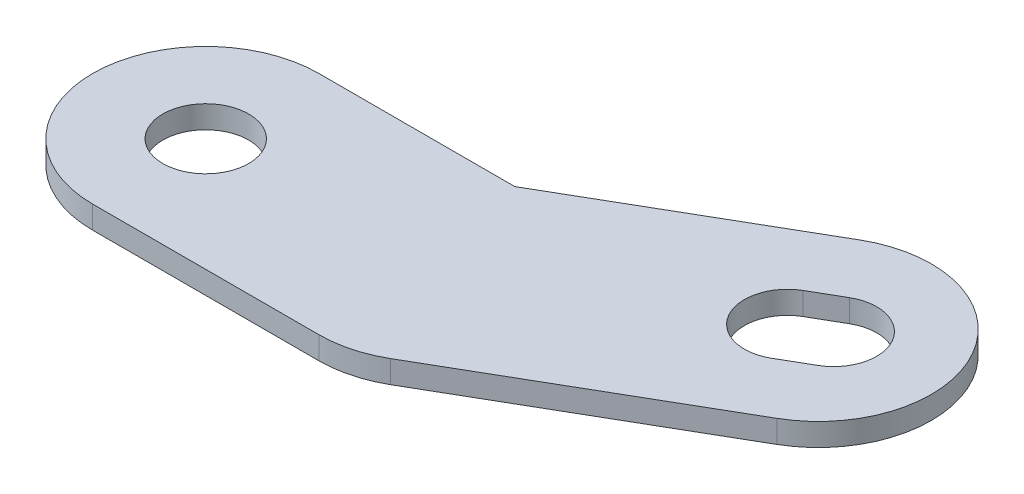
from build123d import *

# Parameters (mm, degrees)
BOSS_EXTRUDE1_DEPTH   = 1
F_6_CLEARANCE_HOLE1_D = 3.7973


with BuildPart() as part:
    # Sketch1 → Boss-Extrude1 (new body)
    # profile 1 of 3: a face of its own
    with BuildSketch(Plane(origin=(0, 0, 0), x_dir=(1, 0, 0), z_dir=(0, 1, 0))):
        with BuildLine():
            Line((0.660254038, 5), (-8, 5))
            ThreePointArc((-8, 5), (-13, 0), (-8, -5))
            Line((-8, -5), (2, -5))
            ThreePointArc((2, -5), (-2.829629131, -1.294095226), (-0.5, 4.330127019))
            Line((-0.5, 4.330127019), (0.660254038, 5))
        make_face()
    # profile 2 of 3: a face of its own
    with BuildSketch(Plane(origin=(0, 0, 0), x_dir=(1, 0, 0), z_dir=(0, 1, 0))):
        with BuildLine():
            Line((2, 5), (0.660254038, 5))
            Line((0.660254038, 5), (-0.5, 4.330127019))
            ThreePointArc((-0.5, 4.330127019), (-2.829629131, -1.294095226), (2, -5))
            ThreePointArc((2, -5), (3.294095226, -4.829629131), (4.5, -4.330127019))
            ThreePointArc((4.5, -4.330127019), (6.829629131, 1.294095226), (2, 5))
        make_face()
    # profile 3 of 3: a face of its own
    with BuildSketch(Plane(origin=(0, 0, 0), x_dir=(1, 0, 0), z_dir=(0, 1, 0))):
        with BuildLine():
            Line((10.325317547, 10.580127019), (0.660254038, 5))
            Line((0.660254038, 5), (2, 5))
            ThreePointArc((2, 5), (6.829629131, 1.294095226), (4.5, -4.330127019))
            Line((4.5, -4.330127019), (15.325317547, 1.919872981))
            ThreePointArc((15.325317547, 1.919872981), (17.155444566, 8.75), (10.325317547, 10.580127019))
        make_face()
        with BuildLine():
            ThreePointArc((12.909292144, 4.104551733), (10.313843876, 4.8), (11.009292144, 7.395448267))
            Line((11.009292144, 7.395448267), (12.308330249, 8.145448267))
            ThreePointArc((12.308330249, 8.145448267), (14.903778516, 7.45), (14.208330249, 4.854551733))
            Line((14.208330249, 4.854551733), (12.909292144, 4.104551733))
        make_face(mode=Mode.SUBTRACT)
    extrude(amount=BOSS_EXTRUDE1_DEPTH)

    # #6 Clearance Hole1 (through all)
    with Locations(Plane(origin=(0, 1, 0), x_dir=(1, 0, 0), z_dir=(0, 1, 0))):
        with Locations((-8, 0)):
            Hole(F_6_CLEARANCE_HOLE1_D / 2)


solid = part.part
